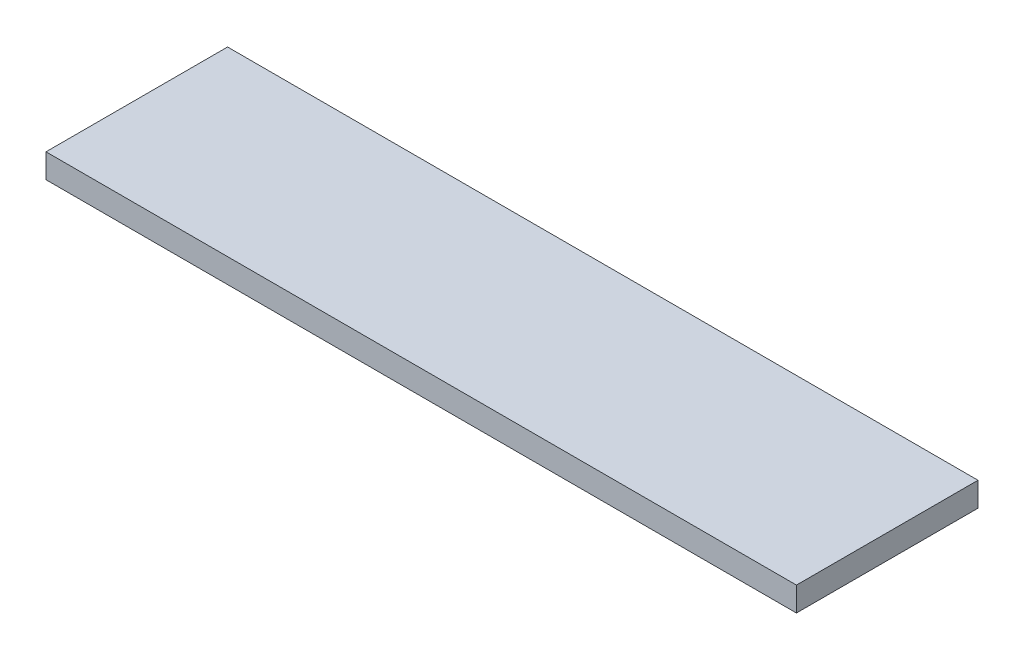
from build123d import *

# Parameters (mm, degrees)
SKETCH1_W           = 62
SKETCH1_H           = 15
BOSS_EXTRUDE1_DEPTH = 2


with BuildPart() as part:
    # Sketch1 → Boss-Extrude1 (new body)
    with BuildSketch(Plane(origin=(0, 0, 0), x_dir=(1, 0, 0), z_dir=(0, 1, 0))):
        with Locations((31, 7.5)):
            Rectangle(SKETCH1_W, SKETCH1_H)
    extrude(amount=BOSS_EXTRUDE1_DEPTH)


solid = part.part
